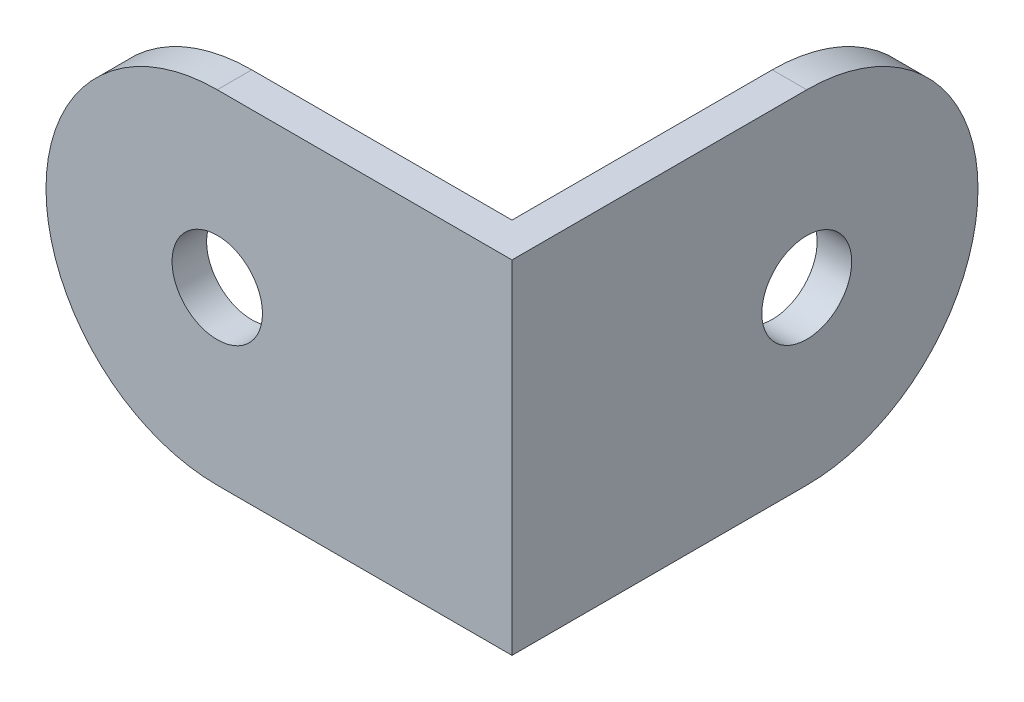
from build123d import *

# Parameters (mm, degrees)
EXTRUDE_THIN1_DEPTH = 15.875
FILLET1_RADIUS      = 7.9375
FILLET1_LENGTH      = 1.6
FILLET2_RADIUS      = 7.9375
FILLET2_LENGTH      = 1.6
SKETCH2_R           = 2.0825
CUT_EXTRUDE1_DEPTH  = 10
SKETCH3_R           = 2.0955
CUT_EXTRUDE2_DEPTH  = 10


with BuildPart() as part:
    # Sketch1 → Extrude-Thin1 (new body)
    with BuildSketch(Plane(origin=(0, 0, 0), x_dir=(1, 0, 0), z_dir=(0, 1, 0))):
        Polygon((0, 20), (0, 0), (-20, 0), (-20, -1.6), (1.6, -1.6), (1.6, 20), align=None)
    extrude(amount=EXTRUDE_THIN1_DEPTH)

    # Fillet1: full round fillet: the end face becomes a half cylinder, R = half its width
    fillet1_face = Plane((0.8, 7.9375, -20), x_dir=(1, 0, 0), z_dir=(0, 0, -1))  # on the end face: x along it, z out of the body
    fillet1_slab = fillet1_face.offset(-FILLET1_RADIUS / 2) * Box(FILLET1_LENGTH, 2 * FILLET1_RADIUS, FILLET1_RADIUS, mode=Mode.PRIVATE)  # the body's end, R deep
    fillet1_round = Plane((0.8, 7.9375, -12.0625), x_dir=(0, 0, -1), z_dir=(1, 0, 0)) * Cylinder(FILLET1_RADIUS, FILLET1_LENGTH, mode=Mode.PRIVATE)  # its axis R under the face
    add(fillet1_slab - fillet1_round, mode=Mode.SUBTRACT)

    # Fillet2: full round fillet: the end face becomes a half cylinder, R = half its width
    fillet2_face = Plane((-20, 7.9375, 0.8), x_dir=(0, 0, 1), z_dir=(-1, 0, 0))  # on the end face: x along it, z out of the body
    fillet2_slab = fillet2_face.offset(-FILLET2_RADIUS / 2) * Box(FILLET2_LENGTH, 2 * FILLET2_RADIUS, FILLET2_RADIUS, mode=Mode.PRIVATE)  # the body's end, R deep
    fillet2_round = Plane((-12.0625, 7.9375, 0.8), x_dir=(-1, 0, 0), z_dir=(0, 0, 1)) * Cylinder(FILLET2_RADIUS, FILLET2_LENGTH, mode=Mode.PRIVATE)  # its axis R under the face
    add(fillet2_slab - fillet2_round, mode=Mode.SUBTRACT)

    # Sketch2 → Cut-Extrude1 (cut)
    with BuildSketch(Plane.ZY):
        with Locations((-12.0625, 7.9375)):
            Circle(SKETCH2_R)
    extrude(amount=-CUT_EXTRUDE1_DEPTH, mode=Mode.SUBTRACT)

    # Sketch3 → Cut-Extrude2 (cut)
    with BuildSketch(Plane(origin=(0, 0, 0), x_dir=(-1, 0, 0), z_dir=(0, 0, -1))):
        with Locations((12.0625, 7.9375)):
            Circle(SKETCH3_R)
    extrude(amount=-CUT_EXTRUDE2_DEPTH, mode=Mode.SUBTRACT)


solid = part.part
